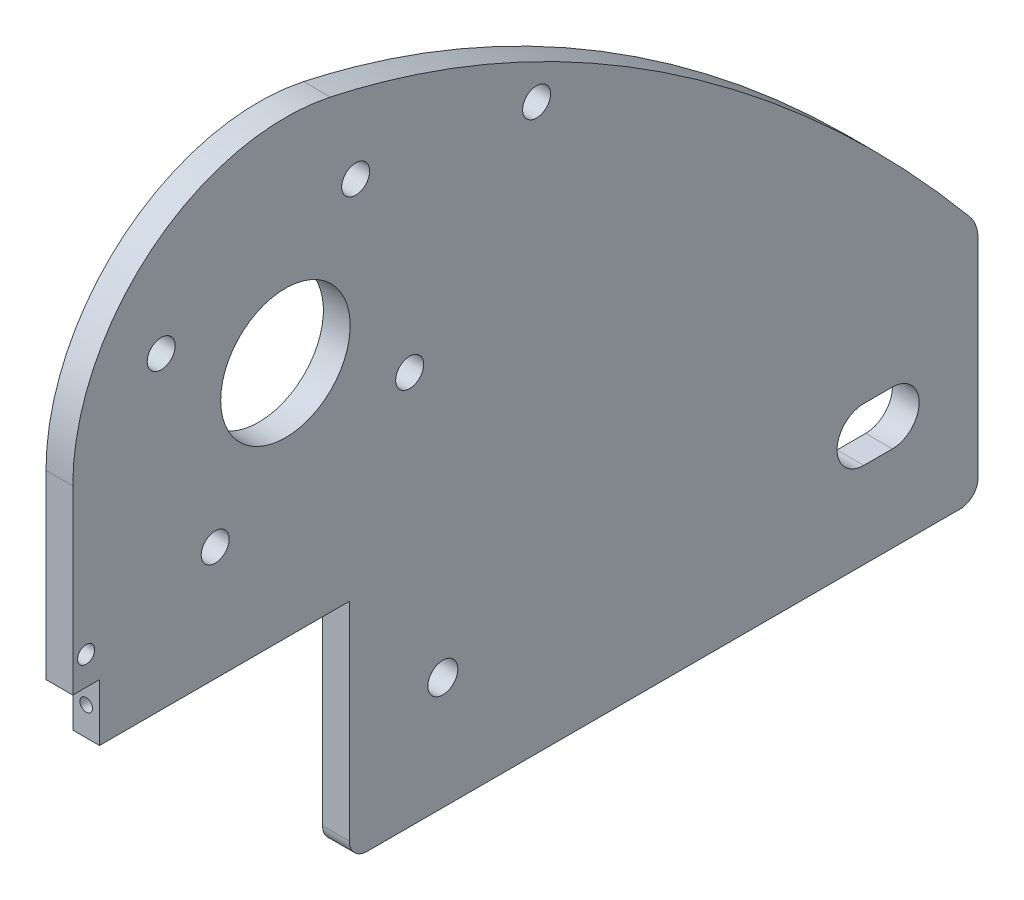
from build123d import *

# Parameters (mm, degrees)
SKETCH1_R           = 2.4892
SKETCH1_R_2         = 2.667
SKETCH1_R_3         = 1.524
SKETCH1_R_4         = 11.522750336
BOSS_EXTRUDE1_DEPTH = 4.7625
SKETCH2_R           = 1.1303
CUT_EXTRUDE1_DEPTH  = 6.35


with BuildPart() as part:
    # Sketch1 → Boss-Extrude1 (new body)
    with BuildSketch(Plane(origin=(0, 0, 0), x_dir=(0, 0, -1), z_dir=(1, 0, 0))):
        with BuildLine():
            Line((-28.170295117, 0), (77.382795117, 0))
            ThreePointArc((77.382795117, 0), (79.627859148, 0.92993597), (80.557795117, 3.175))
            Line((80.557795117, 3.175), (80.557795117, 40.132))
            ThreePointArc((80.557795117, 40.132), (80.179263316, 42.291645237), (79.088797464, 44.193811922))
            add(Edge.make_bspline(
                [(79.088797464, 44.193811922), (50.66748195, 78.347167709), (10.80796538, 109.687612786), (-34.696393838, 119.542430976)],
                knots=[0, 0, 0, 0, 1, 1, 1, 1], degree=3))
            ThreePointArc((-34.696393838, 119.542430976), (-66.471117292, 112.010601135), (-80.557795117, 82.55))
            Line((-80.557795117, 82.55), (-80.557795117, 50.292))
            Line((-80.557795117, 50.292), (-75.795295117, 50.292))
            Line((-75.795295117, 50.292), (-75.795295117, 40.132))
            Line((-75.795295117, 40.132), (-31.345295117, 40.132))
            Line((-31.345295117, 40.132), (-31.345295117, 3.175))
            ThreePointArc((-31.345295117, 3.175), (-30.415359148, 0.92993597), (-28.170295117, 0))
        make_face()
        with Locations((-55.209041359, 60.43939525)):
            Circle(SKETCH1_R, mode=Mode.SUBTRACT)
        with Locations((-14.692204883, 20.066)):
            Circle(SKETCH1_R_2, mode=Mode.SUBTRACT)
        with Locations((-20.597190367, 70.048753759)):
            Circle(SKETCH1_R, mode=Mode.SUBTRACT)
        with Locations((-64.818399868, 95.051246241)):
            Circle(SKETCH1_R, mode=Mode.SUBTRACT)
        with Locations((-30.206548876, 104.66060475)):
            Circle(SKETCH1_R, mode=Mode.SUBTRACT)
        with Locations((-78.176545117, 55.372)):
            Circle(SKETCH1_R_3, mode=Mode.SUBTRACT)
        with Locations((-42.707795117, 82.55)):
            Circle(SKETCH1_R_4, mode=Mode.SUBTRACT)
        with Locations((1.992204883, 100.457)):
            Circle(SKETCH1_R, mode=Mode.SUBTRACT)
        with BuildLine():
            Line((65.317795117, 15.3035), (60.237795117, 15.3035))
            ThreePointArc((60.237795117, 15.3035), (55.475295117, 20.066), (60.237795117, 24.8285))
            Line((60.237795117, 24.8285), (65.317795117, 24.8285))
            ThreePointArc((65.317795117, 24.8285), (70.080295117, 20.066), (65.317795117, 15.3035))
        make_face(mode=Mode.SUBTRACT)
    extrude(amount=BOSS_EXTRUDE1_DEPTH)

    # Sketch2 → Cut-Extrude1 (cut)
    with BuildSketch(Plane.XY.offset(75.795295117)):
        with Locations((2.38125, 45.212)):
            Circle(SKETCH2_R)
    extrude(amount=-CUT_EXTRUDE1_DEPTH, mode=Mode.SUBTRACT)


solid = part.part
